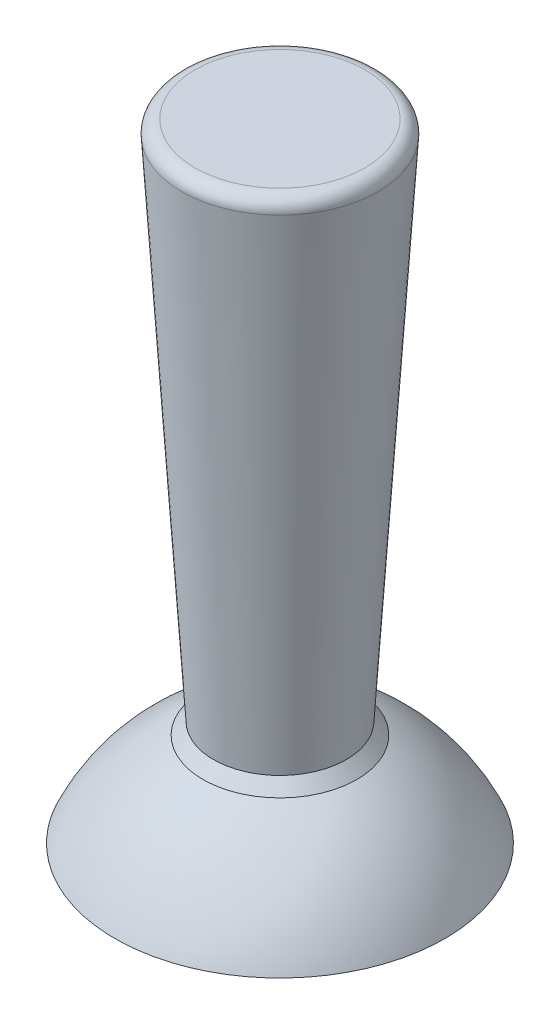
from build123d import *

# Parameters (mm, degrees)
SHELL4_T           = -1
FILLET3_R          = 1
CHAMFER1_SIZE      = 0.5
SKETCH14_RX        = 2.2
SKETCH14_RY        = 1.7
CUT_EXTRUDE1_DEPTH = 8


with BuildPart() as part:
    # Sketch9 → Revolve4 (revolve)
    with BuildSketch(Plane.XY, mode=Mode.PRIVATE) as revolve4_sk:
        with BuildLine():
            Line((0, 0), (12.5, 0))
            ThreePointArc((12.5, 0), (9.435034301, 4.435034301), (5, 7.5))
            Line((5, 7.5), (0, 7.5))
            Line((0, 7.5), (0, 0))
        make_face()
    revolve(revolve4_sk.sketch.rotate(Axis((0, 0, 0), (0, 1, 0)), 90), axis=Axis((0, 0, 0), (0, 1, 0)))

    # Shell4
    shell4_openings = [part.faces().sort_by_distance(p)[0] for p in [
        (0, 0, 0),
    ]]
    offset(amount=SHELL4_T, openings=shell4_openings, kind=Kind.INTERSECTION)

    # Sketch10 → Revolve5 (revolve)
    with BuildSketch(Plane.XY, mode=Mode.PRIVATE) as revolve5_sk:
        Polygon((0, 47.5), (0, 7.5), (2.75, 7.5), (5, 7.5), (7.5, 47.5), align=None)
        Polygon((2.75, 7.5), (0, 7.5), (0, 1.5), (2.75, 1.5), (2.75, 4.5), align=None)
    revolve(revolve5_sk.sketch.rotate(Axis((0, 7.5, 0), (0, 1, 0)), 90), axis=Axis((0, 7.5, 0), (0, 1, 0)))

    # Fillet3
    fillet3_edges = [part.edges().sort_by_distance(p)[0] for p in [
        (0, 47.5, 7.5),
    ]]
    fillet(fillet3_edges, radius=FILLET3_R)

    # Chamfer1
    # the kernel refuses this chamfer: 0.859778685, 0.5 mm, written as the material it adds along each edge
    with BuildSketch(Plane(origin=(0, 7.5, 0), x_dir=(0, 0, -1), z_dir=(1, 0, 0))) as chamfer1_piece_1:
        with BuildLine():
            Line((5 + CHAMFER1_SIZE * 0.0623782861552, CHAMFER1_SIZE * 0.998052578483), (5.829343974, -0.405549185))
            ThreePointArc((5.829343974, -0.405549185), (5.432071901, -0.203384623), (5, 0))
            Line((5, 0), (5 + CHAMFER1_SIZE * 0.0623782861552, CHAMFER1_SIZE * 0.998052578483))
        make_face()
    revolve(axis=Axis((0, 7.5, 0), (0, 1, 0)))

    # Sketch13 → Revolve6 (revolve)
    with BuildSketch(Plane.XY, mode=Mode.PRIVATE) as revolve6_sk:
        Polygon((5, 7.5), (2.75, 4.5), (2.75, 7.5), align=None)
    revolve(revolve6_sk.sketch.rotate(Axis((0, 7.5, 0), (0, -1, 0)), 270), axis=Axis((0, 7.5, 0), (0, -1, 0)))

    # Sketch14 → Cut-Extrude1 (cut)
    with BuildSketch(Plane.XZ.offset(-1.5)):
        with Locations((0, 0)):
            Ellipse(SKETCH14_RX, SKETCH14_RY)
    extrude(amount=-CUT_EXTRUDE1_DEPTH, mode=Mode.SUBTRACT)


solid = part.part
